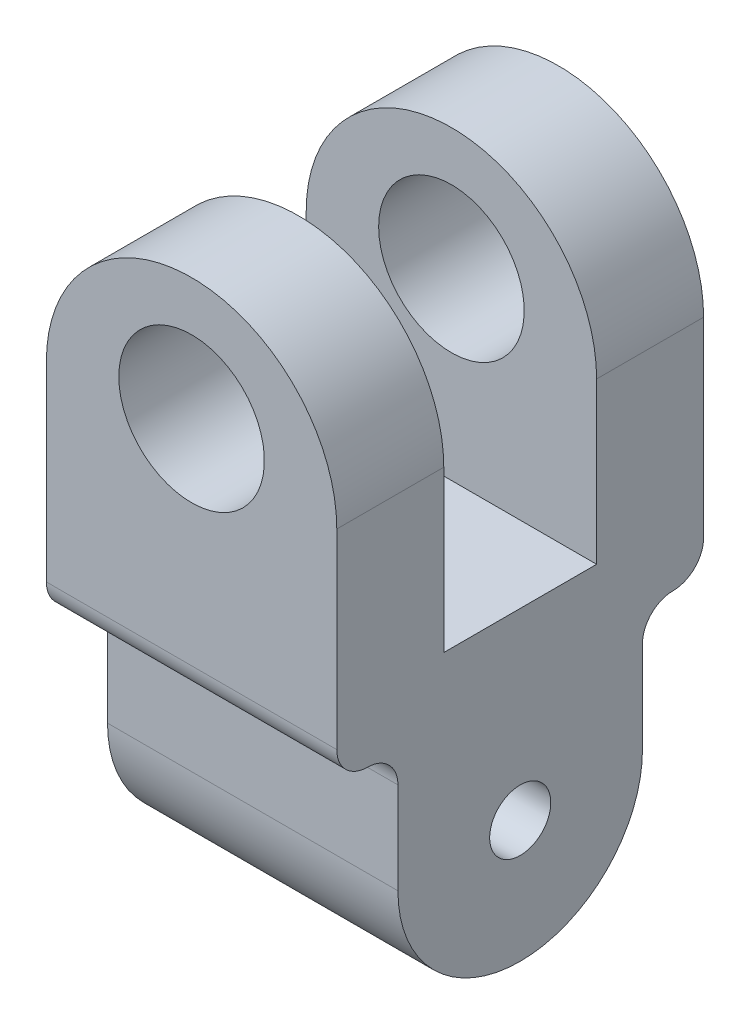
from build123d import *

# Parameters (mm, degrees)
SKETCH1_W           = 9.5
SKETCH1_H           = 12
BOSS_EXTRUDE1_DEPTH = 12
SKETCH2_W           = 13
SKETCH2_H           = 5
CUT_EXTRUDE1_DEPTH  = 10
SKETCH3_R           = 2.38125
CUT_EXTRUDE2_DEPTH  = 18.622783549
CUT_EXTRUDE3_START  = -13
CUT_EXTRUDE3_DEPTH  = 31.622783549
SKETCH6_W           = 9.5
SKETCH6_H           = 8
BOSS_EXTRUDE3_DEPTH = 8
SKETCH7_R           = 1
CUT_EXTRUDE5_DEPTH  = 10
FILLET2_R           = 4
FILLET3_START       = -6
FILLET3_DEPTH       = 12
FILLET3_START_2     = -4.75
FILLET3_2_DEPTH     = 9.5


with BuildPart() as part:
    # Sketch1 → Boss-Extrude1 (new body)
    with BuildSketch(Plane(origin=(0, 0, 0), x_dir=(1, 0, 0), z_dir=(0, 1, 0))):
        Rectangle(SKETCH1_W, SKETCH1_H)
    extrude(amount=BOSS_EXTRUDE1_DEPTH)

    # Sketch2 → Cut-Extrude1 (cut)
    with BuildSketch(Plane(origin=(0, 12, 0), x_dir=(1, 0, 0), z_dir=(0, 1, 0))):
        Rectangle(SKETCH2_W, SKETCH2_H)
    extrude(amount=-CUT_EXTRUDE1_DEPTH, mode=Mode.SUBTRACT)

    # Sketch3 → Cut-Extrude2 (cut, through all)
    with BuildSketch(Plane(origin=(0, 0, -6), x_dir=(-1, 0, 0), z_dir=(0, 0, -1))):
        with Locations((0, 8)):
            Circle(SKETCH3_R)
    extrude(amount=-CUT_EXTRUDE2_DEPTH, mode=Mode.SUBTRACT)

    # Sketch4 → Cut-Extrude3 (cut)
    with BuildSketch(Plane(origin=(0, 0, -6), x_dir=(-1, 0, 0), z_dir=(0, 0, -1)).offset(CUT_EXTRUDE3_START)):
        with BuildLine():
            Line((-4.75, 12), (-4.75, 7.25))
            ThreePointArc((-4.75, 7.25), (-3.358757211, 10.608757211), (0, 12))
            Line((0, 12), (-4.75, 12))
        make_face()
    cut_extrude3 = extrude(amount=CUT_EXTRUDE3_DEPTH, mode=Mode.SUBTRACT)

    # Mirror1: Cut-Extrude3 across plane
    add(cut_extrude3.mirror(Plane(origin=(0, 0, 0), x_dir=(0, 0, 1), z_dir=(1, 0, 0))), mode=Mode.SUBTRACT)

    # Sketch6 → Boss-Extrude3 (add)
    with BuildSketch(Plane.XZ):
        Rectangle(SKETCH6_W, SKETCH6_H)
    extrude(amount=BOSS_EXTRUDE3_DEPTH)

    # Sketch7 → Cut-Extrude5 (cut)
    with BuildSketch(Plane.ZY.offset(4.75)):
        with Locations((0, -4)):
            Circle(SKETCH7_R)
    extrude(amount=-CUT_EXTRUDE5_DEPTH, mode=Mode.SUBTRACT)

    # Fillet2
    fillet2_edges = [part.edges().sort_by_distance(p)[0] for p in [
        (0, -8, 4),
        (0, -8, -4),
    ]]
    fillet(fillet2_edges, radius=FILLET2_R - 0.0001)  # a hair under: the kernel refuses the full size

    # Fillet3: read off the stored shape, not the designer's step
    # Fillet3 outline → Fillet3 (cut)
    with BuildSketch(Plane.YZ.offset(FILLET3_START)):
        with BuildLine():
            Line((0, 6), (0, 5))
            ThreePointArc((0, 5), (0.292893219, 5.707106781), (1, 6))
            Line((1, 6), (0, 6))
        make_face()
        with BuildLine():
            ThreePointArc((1, -6), (0.292893219, -5.707106781), (0, -5))
            Line((0, -5), (0, -6))
            Line((0, -6), (1, -6))
        make_face()
    extrude(amount=FILLET3_DEPTH, mode=Mode.SUBTRACT)

    # Fillet3 2 outline → Fillet3 2 (add)
    with BuildSketch(Plane.YZ.offset(FILLET3_START_2)):
        with BuildLine():
            Line((0, 4), (0, 5))
            ThreePointArc((0, 5), (-0.292893219, 4.292893219), (-1, 4))
            Line((-1, 4), (0, 4))
        make_face()
        with BuildLine():
            ThreePointArc((-1, -4), (-0.292893219, -4.292893219), (0, -5))
            Line((0, -5), (0, -4))
            Line((0, -4), (-1, -4))
        make_face()
    extrude(amount=FILLET3_2_DEPTH)


solid = part.part
